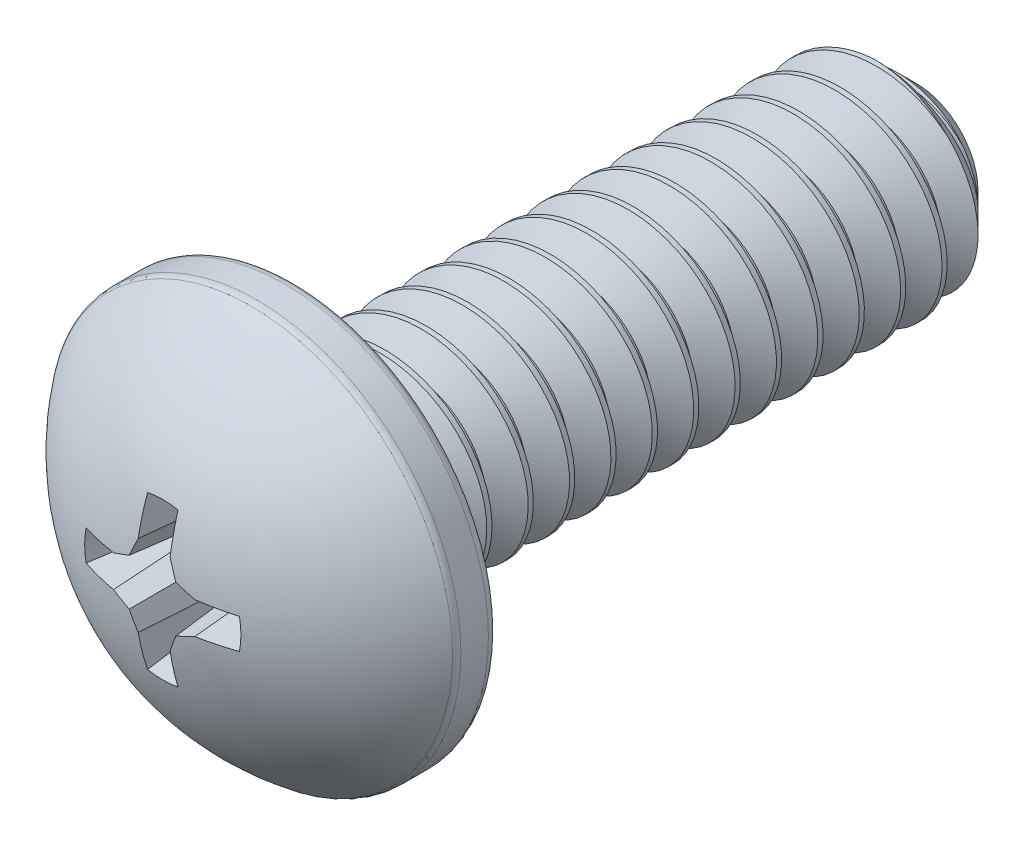
from build123d import *

# Parameters (mm, degrees)
CUT_EXTRUDE1_DEPTH = 2.667
DRAFT1_ANGLE       = 15.000000000000034
DRAFT2_ANGLE       = 5.000000000000011
CUT_SWEEP1_PITCH   = 1.2699999999999896
CUT_SWEEP1_TO      = 19.05


with BuildPart() as part:
    # Sketch2 → Revolve1 (revolve)
    with BuildSketch(Plane(origin=(0, 0, 0), x_dir=(0, 0, -1), z_dir=(1, 0, 0)), mode=Mode.PRIVATE) as revolve1_sk:
        with BuildLine():
            Line((11.747499999999993, -6.1e-16), (11.747500000000008, 1.9050000000000018))
            Line((11.747500000000008, 1.9050000000000018), (10.477500000000001, 3.1750000000000007))
            Line((10.477500000000001, 3.1750000000000007), (-7.3024999999999896, 3.1749999999999985))
            Line((-7.3024999999999896, 3.1749999999999985), (-7.3024999999999896, 5.930899999999999))
            ThreePointArc((-7.3024999999999896, 5.930899999999999), (-7.39549359697326, 6.155406403026727), (-7.619999999999988, 6.248399999999999))
            Line((-7.619999999999988, 6.248399999999999), (-8.46774580297982, 6.2484))
            ThreePointArc((-8.46774580297982, 6.2484), (-8.568277979089205, 6.232063629222906), (-8.658464763677639, 6.184735631916295))
            ThreePointArc((-8.658464763677639, 6.184735631916295), (-10.932287622403537, 3.456627457795248), (-11.747499999999993, -6.1e-16))
            Line((-11.747499999999993, -6.1e-16), (11.747499999999993, -6.1e-16))
        make_face()
    revolve(revolve1_sk.sketch.rotate(Axis((0, -6.1e-16, 11.747499999999993), (0, 0, -1)), 90), axis=Axis((0, -6.1e-16, 11.747499999999993), (0, 0, -1)))

    # Sketch3 → Cut-Extrude1 (cut)
    with BuildSketch(Plane.XY.offset(11.747499999999993)):
        with BuildLine():
            Line((0.4999999999999993, 1.2500000000000089), (0.7196699141100877, 0.7196699141100846))
            Line((0.7196699141100877, 0.7196699141100846), (1.250000000000011, 0.49999999999999395))
            Line((1.250000000000011, 0.49999999999999395), (2.449489742783202, 0.49999999999999395))
            ThreePointArc((2.449489742783202, 0.49999999999999395), (2.500000000000022, -1e-17), (2.449489742783202, -0.49999999999999395))
            Line((2.449489742783202, -0.49999999999999395), (1.250000000000011, -0.49999999999999395))
            Line((1.250000000000011, -0.49999999999999395), (0.7196699141100877, -0.7196699141100846))
            Line((0.7196699141100877, -0.7196699141100846), (0.4999999999999993, -1.2500000000000089))
            Line((0.4999999999999993, -1.2500000000000089), (0.49999999999999895, -2.4494897427831996))
            ThreePointArc((0.49999999999999895, -2.4494897427831996), (1.5e-16, -2.500000000000021), (-0.49999999999999895, -2.4494897427831996))
            Line((-0.49999999999999895, -2.4494897427831996), (-0.4999999999999993, -1.2500000000000089))
            Line((-0.4999999999999993, -1.2500000000000089), (-0.7196699141100877, -0.7196699141100846))
            Line((-0.7196699141100877, -0.7196699141100846), (-1.250000000000011, -0.49999999999999395))
            Line((-1.250000000000011, -0.49999999999999395), (-2.449489742783202, -0.49999999999999395))
            ThreePointArc((-2.449489742783202, -0.49999999999999395), (-2.500000000000022, 9e-17), (-2.449489742783202, 0.49999999999999395))
            Line((-2.449489742783202, 0.49999999999999395), (-1.250000000000011, 0.49999999999999395))
            Line((-1.250000000000011, 0.49999999999999395), (-0.7196699141100877, 0.7196699141100846))
            Line((-0.7196699141100877, 0.7196699141100846), (-0.4999999999999993, 1.2500000000000089))
            Line((-0.4999999999999993, 1.2500000000000089), (-0.49999999999999895, 2.4494897427831996))
            ThreePointArc((-0.49999999999999895, 2.4494897427831996), (1.5e-16, 2.500000000000021), (0.49999999999999895, 2.4494897427831996))
            Line((0.49999999999999895, 2.4494897427831996), (0.4999999999999993, 1.2500000000000089))
        make_face()
    extrude(amount=-CUT_EXTRUDE1_DEPTH, mode=Mode.SUBTRACT)

    # Draft1
    draft1_faces = [part.faces().sort_by_distance(p)[0] for p in [
        (2.500000000000022, 0, 10.206451960950426),
        (0, 2.5000000000000213, 10.206451960950428),
        (0, -2.5000000000000213, 10.206451960950432),
        (-2.5000000000000226, -1.1e-16, 10.206451960950432),
    ]]
    draft(draft1_faces, Plane.XY.offset(11.747499999999993), DRAFT1_ANGLE)

    # Draft2
    draft2_faces = [part.faces().sort_by_distance(p)[0] for p in [
        (0.49999999999999917, 1.6591793275288844, 10.466244575024389),
        (1.6591793275288864, -0.49999999999999395, 10.466244575024387),
        (0.49999999999999917, -1.6591793275254338, 10.466244575001946),
        (-0.49999999999999917, -1.6591793275288844, 10.46624457502439),
        (-1.6591793272736224, -0.49999999999999395, 10.466244573364232),
        (-1.6591793275288875, 0.49999999999999395, 10.46624457502439),
        (-0.49999999999999917, 1.6591793272029118, 10.466244572904372),
        (1.6591793275288702, 0.49999999999999395, 10.466244575024282),
        (0.9839642361272065, 0.6101956214723939, 10.369529089323873),
        (0.6101956214723981, 0.9839642361272037, 10.369529089323875),
        (0.9839642361272063, -0.610195621472394, 10.369529089323873),
        (0.6101956214723981, -0.9839642361272037, 10.369529089323873),
        (-0.6101956214723981, -0.9839642361272037, 10.369529089323875),
        (-0.9839642361272065, -0.6101956214723939, 10.369529089323875),
        (-0.9839642361272063, 0.6101956214723939, 10.369529089323875),
        (-0.6101956214723981, 0.9839642361272037, 10.369529089323875),
    ]]
    draft(draft2_faces, Plane.XY.offset(11.747499999999993), DRAFT2_ANGLE)


with BuildPart() as body_2:
    # Split1: read off the stored shape, not the designer's step
    # Split1: the piece on the far side of the plane
    add(part.part)
    split(bisect_by=Plane.XY.offset(7.3025), keep=Keep.BOTTOM)

    # Cut-Sweep1: arcs per turn and ends read off the stored shape
    # Cut-Sweep1: the profile of Sketch5 screwed along a right-hand helix through 16 turns, 8 arcs to a turn; built about Z, then put on its axis
    cut_sweep1_z = Axis((0, 0, 0), (0, 0, 1))
    cut_sweep1_corners = [(3.243740766, 0, 0.0396875), (2.350110803, 0, -0.47625), (2.350110803, 0, -0.635), (3.243740766, 0, -1.1509375)]
    with BuildLine(mode=Mode.PRIVATE) as cut_sweep1_profile:
        Line(cut_sweep1_corners[0], cut_sweep1_corners[1])
        Line(cut_sweep1_corners[1], cut_sweep1_corners[2])
        Line(cut_sweep1_corners[2], cut_sweep1_corners[3])
        Line(cut_sweep1_corners[3], cut_sweep1_corners[0])
    cut_sweep1_cap = Face(cut_sweep1_profile.wire())
    cut_sweep1_turn_angles = [0, 22.5, 45, 67.5, 90, 112.5, 135, 157.5, 180, 202.5, 225, 247.5, 270, 292.5, 315, 337.5, 360]
    cut_sweep1_turn_weights = [1, 0.9238795325112867, 1, 0.9238795325112867, 1, 0.9238795325112867, 1, 0.9238795325112867, 1, 0.9238795325112867, 1, 0.9238795325112867, 1, 0.9238795325112867, 1, 0.9238795325112867, 1]
    cut_sweep1_turn_rails = [Edge.make_bspline([Vector(p[0], p[1], 0).rotate(cut_sweep1_z, cut_sweep1_turn_angles[k]) / cut_sweep1_turn_weights[k] + Vector(0, 0, p[2] + CUT_SWEEP1_PITCH * cut_sweep1_turn_angles[k] / 360) for k in range(17)], [0, 0, 0, 1, 1, 2, 2, 3, 3, 4, 4, 5, 5, 6, 6, 7, 7, 8, 8, 8], 2, cut_sweep1_turn_weights) for p in cut_sweep1_corners]
    cut_sweep1_turn_sides = [Face.make_surface_from_curves(cut_sweep1_turn_rails[p[0]], cut_sweep1_turn_rails[p[1]]) for p in [(0, 1), (1, 2), (2, 3), (3, 0)]]
    cut_sweep1 = Plane(origin=(0, -7.6e-16, -11.7475), x_dir=(3.49e-15, 1, 0), z_dir=(0, 0, 1)) * split(Solid(Shell([*[p.moved(Location((0, 0, CUT_SWEEP1_PITCH * i))) for i in range(16) for p in cut_sweep1_turn_sides], cut_sweep1_cap, cut_sweep1_cap.rotate(cut_sweep1_z, 5760).moved(Location((0, 0, CUT_SWEEP1_PITCH * 5760 / 360)))])), bisect_by=Plane.XY.offset(CUT_SWEEP1_TO), keep=Keep.BOTTOM, mode=Mode.PRIVATE)
    add(cut_sweep1, mode=Mode.SUBTRACT)


with BuildPart() as part_1:
    add(part.part)

    # Split1
    split(bisect_by=Plane.XY.offset(7.3025), keep=Keep.TOP)

    add(body_2.part)  # Boss-Extrude1 merges body 2
    # Boss-Extrude1: read off the stored shape, not the designer's step
    # Boss-Extrude1 outline → Boss-Extrude1 (revolve)
    with BuildSketch(Plane.XZ):
        Polygon((2.350109328, 7.3025), (2.350109328, 5.036131506), (3.175, 7.3025), align=None)
    revolve(axis=Axis((0, 0, 0), (0, 0, 1)))


solid = part_1.part
